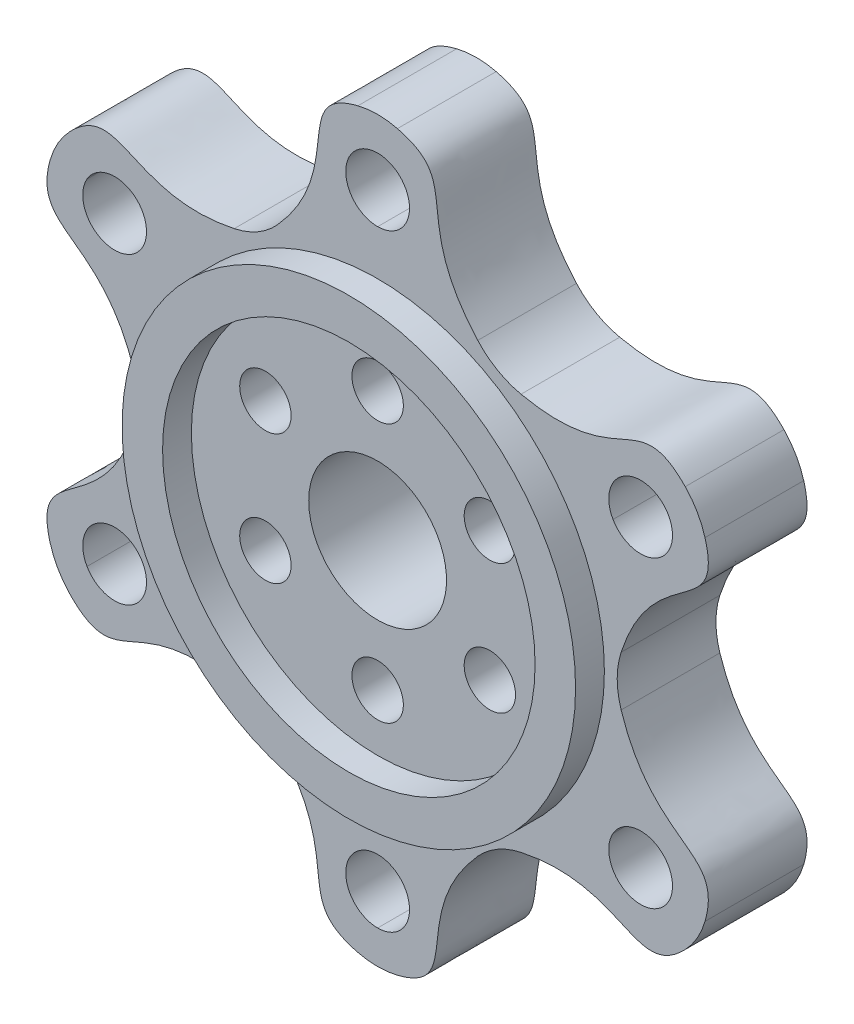
from build123d import *

# Parameters (mm, degrees)
SKETCH1_R           = 45.72
SKETCH1_R_2         = 8.509
SKETCH1_R_3         = 3.175
SKETCH1_R_4         = 3.937
BOSS_EXTRUDE3_DEPTH = 12.192
CUT_EXTRUDE1_START  = -22.86
CUT_EXTRUDE1_DEPTH  = 22.86
SKETCH4_R           = 28
SKETCH4_R_2         = 23
BOSS_EXTRUDE4_DEPTH = 3.556
FILLET1_R           = 10


with BuildPart() as part:
    # Sketch1 → Boss-Extrude3 (new body)
    with BuildSketch(Plane.XY):
        Circle(SKETCH1_R)
        Circle(SKETCH1_R_2, mode=Mode.SUBTRACT)
        with Locations((0, 16.002)):
            Circle(SKETCH1_R_3, mode=Mode.SUBTRACT)
        with Locations((13.858138511, 8.001)):
            Circle(SKETCH1_R_3, mode=Mode.SUBTRACT)
        with Locations((13.858138511, -8.001)):
            Circle(SKETCH1_R_3, mode=Mode.SUBTRACT)
        with Locations((0, -16.002)):
            Circle(SKETCH1_R_3, mode=Mode.SUBTRACT)
        with Locations((-13.858138511, -8.001)):
            Circle(SKETCH1_R_3, mode=Mode.SUBTRACT)
        with Locations((-13.858138511, 8.001)):
            Circle(SKETCH1_R_3, mode=Mode.SUBTRACT)
        with Locations((0, 37.5)):
            Circle(SKETCH1_R_4, mode=Mode.SUBTRACT)
        with Locations((32.475952642, 18.75)):
            Circle(SKETCH1_R_4, mode=Mode.SUBTRACT)
        with Locations((32.475952642, -18.75)):
            Circle(SKETCH1_R_4, mode=Mode.SUBTRACT)
        with Locations((0, -37.5)):
            Circle(SKETCH1_R_4, mode=Mode.SUBTRACT)
        with Locations((-32.475952642, -18.75)):
            Circle(SKETCH1_R_4, mode=Mode.SUBTRACT)
        with Locations((-32.475952642, 18.75)):
            Circle(SKETCH1_R_4, mode=Mode.SUBTRACT)
    extrude(amount=BOSS_EXTRUDE3_DEPTH)

    # Sketch2 → Cut-Extrude1 (cut)
    with BuildSketch(Plane.XY.offset(12.192).offset(CUT_EXTRUDE1_START)):
        with BuildLine():
            ThreePointArc((39.594681461, -22.86), (45.72, 0), (39.594681461, 22.86))
            add(Edge.make_bspline(
                [(29.25, 0), (32.932092251, 17.195322725), (44.628878831, 10.61767176), (39.594681461, 22.86)],
                knots=[0, 0, 0, 0, 1, 1, 1, 1], degree=3))
            add(Edge.make_bspline(
                [(29.25, 0), (32.932092251, -17.195322725), (44.628878831, -10.61767176), (39.594681461, -22.86)],
                knots=[0, 0, 0, 0, 1, 1, 1, 1], degree=3))
        make_face()
        with BuildLine():
            add(Edge.make_bspline(
                [(14.625, 25.331243061), (31.357632431, 19.922367126), (31.509612889, 33.34090693), (39.594681461, 22.86)],
                knots=[0, 0, 0, 0, 1, 1, 1, 1], degree=3))
            ThreePointArc((39.594681461, 22.86), (22.86, 39.594681461), (0, 45.72))
            add(Edge.make_bspline(
                [(14.625, 25.331243061), (1.574459819, 37.117689851), (13.119265943, 43.95857869), (0, 45.72)],
                knots=[0, 0, 0, 0, 1, 1, 1, 1], degree=3))
        make_face()
        with BuildLine():
            ThreePointArc((0, -45.72), (22.86, -39.594681461), (39.594681461, -22.86))
            add(Edge.make_bspline(
                [(14.625, -25.331243061), (31.357632431, -19.922367126), (31.509612889, -33.34090693), (39.594681461, -22.86)],
                knots=[0, 0, 0, 0, 1, 1, 1, 1], degree=3))
            add(Edge.make_bspline(
                [(14.625, -25.331243061), (1.574459819, -37.117689851), (13.119265943, -43.95857869), (0, -45.72)],
                knots=[0, 0, 0, 0, 1, 1, 1, 1], degree=3))
        make_face()
        with BuildLine():
            add(Edge.make_bspline(
                [(-14.625, 25.331243061), (-1.574459819, 37.117689851), (-13.119265943, 43.95857869), (0, 45.72)],
                knots=[0, 0, 0, 0, 1, 1, 1, 1], degree=3))
            ThreePointArc((0, 45.72), (-22.86, 39.594681461), (-39.594681461, 22.86))
            add(Edge.make_bspline(
                [(-14.625, 25.331243061), (-31.357632431, 19.922367126), (-31.509612889, 33.34090693), (-39.594681461, 22.86)],
                knots=[0, 0, 0, 0, 1, 1, 1, 1], degree=3))
        make_face()
        with BuildLine():
            ThreePointArc((-39.594681461, -22.86), (-22.86, -39.594681461), (0, -45.72))
            add(Edge.make_bspline(
                [(-14.625, -25.331243061), (-1.574459819, -37.117689851), (-13.119265943, -43.95857869), (0, -45.72)],
                knots=[0, 0, 0, 0, 1, 1, 1, 1], degree=3))
            add(Edge.make_bspline(
                [(-14.625, -25.331243061), (-31.357632431, -19.922367126), (-31.509612889, -33.34090693), (-39.594681461, -22.86)],
                knots=[0, 0, 0, 0, 1, 1, 1, 1], degree=3))
        make_face()
        with BuildLine():
            add(Edge.make_bspline(
                [(-29.25, 0), (-32.932092251, 17.195322725), (-44.628878831, 10.61767176), (-39.594681461, 22.86)],
                knots=[0, 0, 0, 0, 1, 1, 1, 1], degree=3))
            ThreePointArc((-39.594681461, 22.86), (-45.72, 0), (-39.594681461, -22.86))
            add(Edge.make_bspline(
                [(-29.25, 0), (-32.932092251, -17.195322725), (-44.628878831, -10.61767176), (-39.594681461, -22.86)],
                knots=[0, 0, 0, 0, 1, 1, 1, 1], degree=3))
        make_face()
    extrude(amount=CUT_EXTRUDE1_DEPTH, mode=Mode.SUBTRACT)

    # Sketch4 → Boss-Extrude4 (add)
    with BuildSketch(Plane.XY.offset(12.192)):
        Circle(SKETCH4_R)
        Circle(SKETCH4_R_2, mode=Mode.SUBTRACT)
    extrude(amount=BOSS_EXTRUDE4_DEPTH)

    # Fillet1
    fillet1_edges = [part.edges().sort_by_distance(p)[0] for p in [
        (29.25, 0, 6.096),
        (39.594681461, -22.86, 6.096),
        (0, -45.72, 6.096),
        (14.625, -25.331243061, 6.096),
        (-14.625, -25.331243061, 6.096),
        (-39.594681461, -22.86, 6.096),
        (-29.25, 0, 6.096),
        (-39.594681461, 22.86, 6.096),
        (-14.625, 25.331243061, 6.096),
        (14.625, 25.331243061, 6.096),
        (39.594681461, 22.86, 6.096),
        (0, 45.72, 6.096),
    ]]
    fillet(fillet1_edges, radius=FILLET1_R)


solid = part.part
